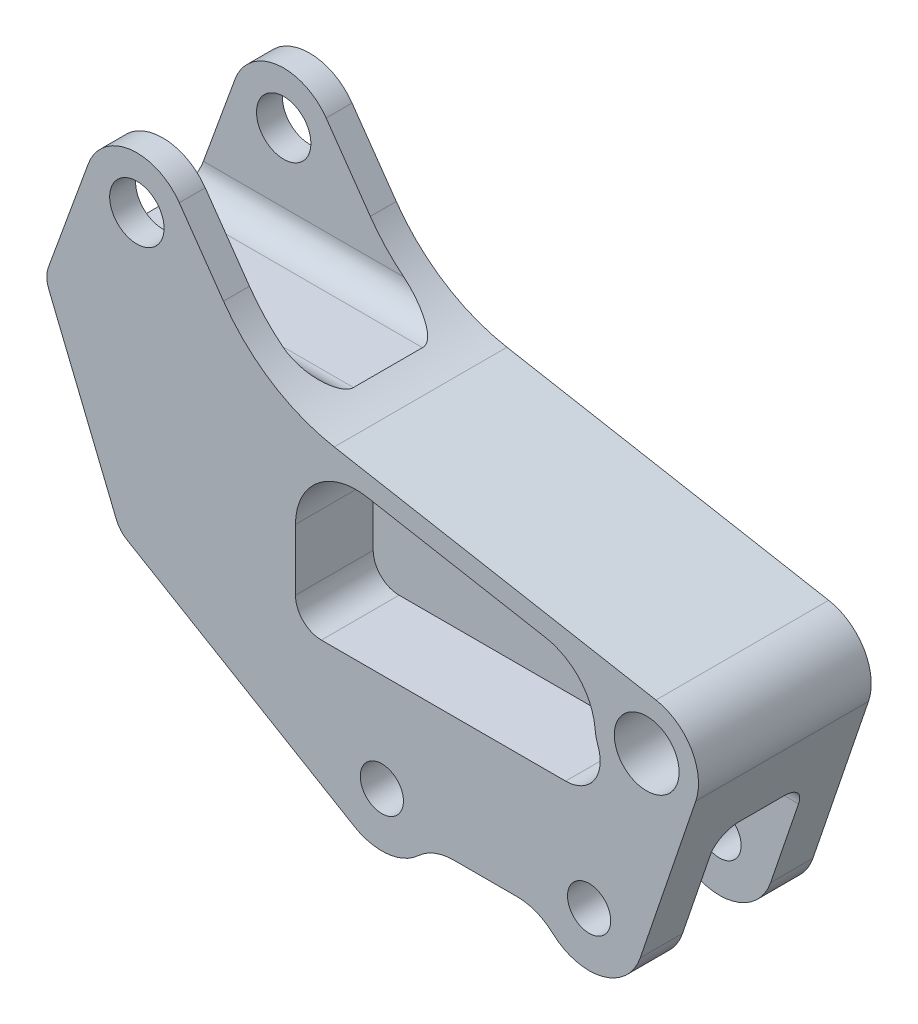
from build123d import *

# Parameters (mm, degrees)
SKETCH1_R           = 4.7625
SKETCH1_R_2         = 4
SKETCH1_R_3         = 3.175
BOSS_EXTRUDE1_DEPTH = 12.7
BOSS_EXTRUDE2_DEPTH = 1.27
SKETCH1_6_R         = 3.175
CUT_EXTRUDE1_DEPTH  = 6.477
SKETCH1_10_R        = 4
CUT_EXTRUDE3_DEPTH  = 8.89
FILLET1_R           = 3.81
FILLET3_R           = 3.81
FILLET4_R           = 3.175
FILLET5_R           = 7.62


with BuildPart() as part:
    # Sketch1 → Boss-Extrude1 (new body)
    with BuildSketch(Plane(origin=(0, 0, 0), x_dir=(0, 1, 0), z_dir=(0, 0, 1))):
        with BuildLine():
            Line((-26.499431941, 0.950631657), (-2.449998994, -7.215393609))
            ThreePointArc((-2.449998994, -7.215393609), (3.866048142, -6.56643524), (7.497932311, -1.358459074))
            Line((7.497932311, -1.358459074), (16.069122988, 45.94970705))
            ThreePointArc((16.069122988, 45.94970705), (19.672222889, 55.119231342), (26.493389209, 62.227972063))
            Line((26.493389209, 62.227972063), (35.774163974, 68.726440514))
            ThreePointArc((35.774163974, 68.726440514), (38.958321373, 75.962988676), (34.009705021, 82.128836862))
            Line((34.009705021, 82.128836862), (16.544511529, 88.485647429))
            Line((16.544511529, 88.485647429), (-10.358349656, 77.508379092))
            Line((-10.358349656, 77.508379092), (-30.779024566, 42.987968953))
            ThreePointArc((-30.779024566, 42.987968953), (-31.601546647, 36.844959103), (-27.757349656, 31.983348043))
            Line((-27.757349656, 31.983348043), (-27.757349656, 15.42998529))
            ThreePointArc((-27.757349656, 15.42998529), (-31.855063811, 7.779670964), (-26.499431941, 0.950631657))
        make_face()
        with Locations(Location((0, 0, 0), (0, 0, 270))):
            Circle(SKETCH1_R, mode=Mode.SUBTRACT)
        with Locations(Location((31.403511529, 74.968379092, 0), (0, 0, 270))):
            Circle(SKETCH1_R_2, mode=Mode.SUBTRACT)
        with Locations(Location((-23.947349656, 38.946666667, 0), (0, 0, 270))):
            Circle(SKETCH1_R_3, mode=Mode.SUBTRACT)
        with Locations(Location((-23.947349656, 8.466666667, 0), (0, 0, 270))):
            Circle(SKETCH1_R_3, mode=Mode.SUBTRACT)
        with BuildLine():
            Line((-9.469349656, 47.836666667), (-9.469349656, 11.917365883))
            ThreePointArc((-9.469349656, 11.917365883), (-7.295140555, 7.750499045), (-2.633609794, 7.15041953))
            ThreePointArc((-2.633609794, 7.15041953), (-1.656512431, 7.437766235), (-0.649822418, 7.592241489))
            ThreePointArc((-0.649822418, 7.592241489), (4.576435948, 9.875722251), (7.339639123, 14.86498764))
            Line((7.339639123, 14.86498764), (12.10584978, 41.171797748))
            ThreePointArc((12.10584978, 41.171797748), (10.181808987, 48.455026751), (3.358262084, 51.646666667))
            Line((3.358262084, 51.646666667), (-5.659349656, 51.646666667))
            ThreePointArc((-5.659349656, 51.646666667), (-8.353426493, 50.530743503), (-9.469349656, 47.836666667))
        make_face(mode=Mode.SUBTRACT)
    extrude(amount=BOSS_EXTRUDE1_DEPTH)

    # Sketch1<4> → Boss-Extrude2 (add)
    with BuildSketch(Plane(origin=(0, 0, 0), x_dir=(0, 1, 0), z_dir=(0, 0, 1))):
        with BuildLine():
            ThreePointArc((-5.659349656, 51.646666667), (-8.353426493, 50.530743503), (-9.469349656, 47.836666667))
            Line((-9.469349656, 47.836666667), (-9.469349656, 11.917365883))
            ThreePointArc((-9.469349656, 11.917365883), (-7.295140555, 7.750499045), (-2.633609794, 7.15041953))
            ThreePointArc((-2.633609794, 7.15041953), (-1.656512431, 7.437766235), (-0.649822418, 7.592241489))
            ThreePointArc((-0.649822418, 7.592241489), (4.576435948, 9.875722251), (7.339639123, 14.86498764))
            Line((7.339639123, 14.86498764), (12.10584978, 41.171797748))
            ThreePointArc((12.10584978, 41.171797748), (10.181808987, 48.455026751), (3.358262084, 51.646666667))
            Line((3.358262084, 51.646666667), (-5.659349656, 51.646666667))
        make_face()
    extrude(amount=BOSS_EXTRUDE2_DEPTH)

    # Sketch1<6> → Cut-Extrude1 (cut)
    with BuildSketch(Plane(origin=(0, 0, 0), x_dir=(0, 1, 0), z_dir=(0, 0, 1))):
        with BuildLine():
            ThreePointArc((-27.757349656, 15.42998529), (-31.855063811, 7.779670964), (-26.499431941, 0.950631657))
            Line((-26.499431941, 0.950631657), (-11.247349656, -4.228238446))
            Line((-11.247349656, -4.228238446), (-11.247349656, 51.646666667))
            Line((-11.247349656, 51.646666667), (-25.656940256, 51.646666667))
            Line((-25.656940256, 51.646666667), (-30.779024566, 42.987968953))
            ThreePointArc((-30.779024566, 42.987968953), (-31.601546647, 36.844959103), (-27.757349656, 31.983348043))
            Line((-27.757349656, 31.983348043), (-27.757349656, 15.42998529))
        make_face()
        with Locations(Location((-23.947349656, 8.466666667, 0), (0, 0, 270))):
            Circle(SKETCH1_6_R, mode=Mode.SUBTRACT)
        with Locations(Location((-23.947349656, 38.946666667, 0), (0, 0, 270))):
            Circle(SKETCH1_6_R, mode=Mode.SUBTRACT)
    extrude(amount=CUT_EXTRUDE1_DEPTH, mode=Mode.SUBTRACT)

    # Sketch1<10> → Cut-Extrude3 (cut)
    # profile 1 of 3: a face of its own
    with BuildSketch(Plane(origin=(0, 0, 0), x_dir=(0, 1, 0), z_dir=(0, 0, 1))):
        with BuildLine():
            Line((17.433511529, 88.162077891), (17.433511529, 50.740503147))
            ThreePointArc((17.433511529, 50.740503147), (21.118462359, 57.150658387), (26.493389209, 62.227972063))
            Line((26.493389209, 62.227972063), (35.774163974, 68.726440514))
            ThreePointArc((35.774163974, 68.726440514), (38.958321373, 75.962988676), (34.009705021, 82.128836862))
            Line((34.009705021, 82.128836862), (17.433511529, 88.162077891))
        make_face()
        with Locations(Location((31.403511529, 74.968379092, 0), (0, 0, 270))):
            Circle(SKETCH1_10_R, mode=Mode.SUBTRACT)
    # profile 2 of 3: a face of its own
    with BuildSketch(Plane(origin=(0, 0, 0), x_dir=(0, 1, 0), z_dir=(0, 0, 1))):
        Polygon((-11.247349656, 76.005556842), (-24.605157851, 53.424666667), (-11.247349656, 53.424666667), align=None)
    # profile 3 of 3: a face of its own
    with BuildSketch(Plane(origin=(0, 0, 0), x_dir=(0, 1, 0), z_dir=(0, 0, 1))):
        Polygon((15.655511529, 88.122905656), (-9.469349656, 77.871120864), (-9.469349656, 53.424666667), (15.655511529, 53.424666667), align=None)
    extrude(amount=CUT_EXTRUDE3_DEPTH, mode=Mode.SUBTRACT)

    # Mirror1: part across face


with BuildPart() as part_1:
    add(part.part)
    add(part.part.mirror(Plane(origin=(-30.744300958, 0.707665305, 0), x_dir=(1, 0, 0), z_dir=(0, 0, -1))))

    # Fillet1
    fillet1_edges = [part_1.edges().sort_by_distance(p)[0] for p in [
        (-69.451290519, 17.433511529, 8.89),
        (-51.646666667, -18.452144956, 6.477),
        (-51.646666667, -18.452144956, -6.477),
        (-53.424666667, -17.926253754, 8.89),
        (-53.424666667, -17.926253754, -8.89),
        (-70.773786162, 15.655511529, 8.89),
        (-65.647893765, -9.469349656, 8.89),
        (-65.647893765, -9.469349656, -8.89),
        (-70.773786162, 15.655511529, -8.89),
        (-69.451290519, 17.433511529, -8.89),
    ]]
    fillet(fillet1_edges, radius=FILLET1_R)

    # Fillet3
    # the kernel refuses this fillet: 3.81 mm, written as the material it takes off along each edge
    with BuildSketch(Plane(origin=(-77.508379092, -10.358349656, -15.90517458), x_dir=(-0.3777939966211631, 0.9258896781566412, 0), z_dir=(0, 0, 1))) as fillet3_piece_1:
        with BuildLine():
            CenterArc((FILLET3_R * 0.336501268256, -FILLET3_R), FILLET3_R, 90, 37.196303294)
            Line((-FILLET3_R * 0.268046453486, -FILLET3_R * 0.203431075087), (0, 0))
            Line((0, 0), (FILLET3_R * 0.336501268256, 0))
        make_face()
    extrude(amount=31.81034916, mode=Mode.SUBTRACT)
    with BuildSketch(Plane(origin=(-88.485647429, 16.544511529, -16.375115103), x_dir=(0.3420201433256622, 0.9396926207859108, 0), z_dir=(0, 0, 1))) as fillet3_piece_2:
        with BuildLine():
            CenterArc((FILLET3_R * 0.385838855973, -FILLET3_R), FILLET3_R, 90, 42.197104506)
            Line((-FILLET3_R * 0.285844295256, -FILLET3_R * 0.259161458646), (0, 0))
            Line((0, 0), (FILLET3_R * 0.385838855973, 0))
        make_face()
    extrude(amount=32.750230206, mode=Mode.SUBTRACT)

    # Fillet4
    fillet4_edges = [part_1.edges().sort_by_distance(p)[0] for p in [
        (-53.424666667, -11.247349656, 0),
        (-66.620111754, -11.247349656, -8.89),
        (-66.620111754, -11.247349656, 8.89),
        (-54.54058983, -11.247349656, -7.774076836),
        (-54.54058983, -11.247349656, 7.774076836),
        (-21.80421411, -11.247349656, 6.477),
        (-51.646666667, -11.247349656, 0),
        (-21.80421411, -11.247349656, -6.477),
        (-50.530743503, -11.247349656, -5.361076836),
        (-50.530743503, -11.247349656, 5.361076836),
    ]]
    fillet(fillet4_edges, radius=FILLET4_R)

    # Fillet5
    fillet5_edges = [part_1.edges().sort_by_distance(p)[0] for p in [
        (-31.983348043, -27.757349656, -9.5885),
        (-15.42998529, -27.757349656, -9.5885),
        (-15.42998529, -27.757349656, 9.5885),
        (-31.983348043, -27.757349656, 9.5885),
    ]]
    fillet(fillet5_edges, radius=FILLET5_R)


solid = part_1.part
